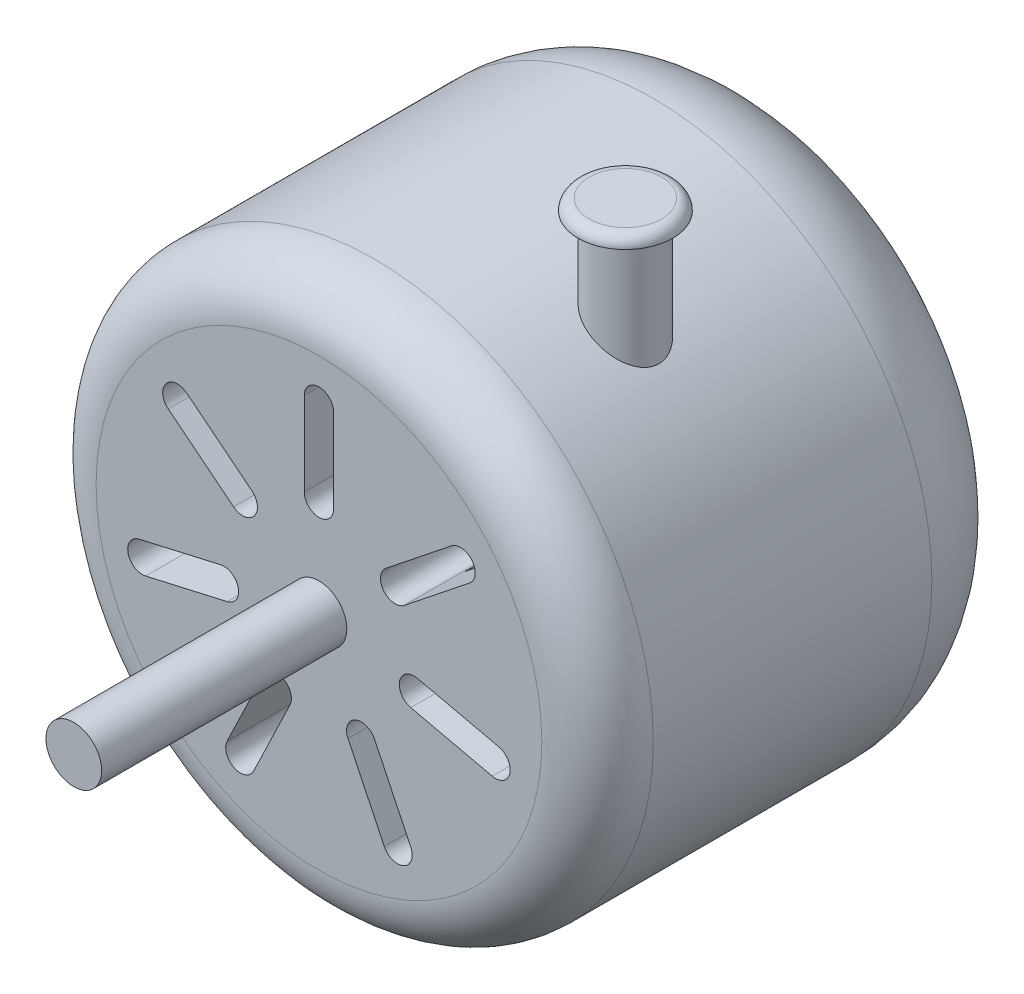
from build123d import *

# Parameters (mm, degrees)
SKETCH2_R           = 50
BOSS_EXTRUDE1_DEPTH = 80
FILLET1_R           = 10
FILLET2_R           = 20
CUT_EXTRUDE1_DEPTH  = 70
CIRPATTERN1_COUNT   = 7
CUT_EXTRUDE2_DEPTH  = 70
CIRPATTERN2_COUNT   = 6
SKETCH5_R           = 5
BOSS_EXTRUDE2_DEPTH = 44
SKETCH6_R           = 6
BOSS_EXTRUDE3_DEPTH = 60
SKETCH7_R           = 8.5
BOSS_EXTRUDE4_DEPTH = 2
FILLET3_R           = 2


with BuildPart() as part:
    # Sketch2 → Boss-Extrude1 (new body)
    with BuildSketch(Plane.XY):
        Circle(SKETCH2_R)
    extrude(amount=BOSS_EXTRUDE1_DEPTH)

    # Fillet1
    fillet1_edges = [part.edges().sort_by_distance(p)[0] for p in [
        (-50, 0, 80),
    ]]
    fillet(fillet1_edges, radius=FILLET1_R)

    # Fillet2
    fillet2_edges = [part.edges().sort_by_distance(p)[0] for p in [
        (-50, 0, 0),
    ]]
    fillet(fillet2_edges, radius=FILLET2_R)

    # Sketch3 → Cut-Extrude1 (cut)
    with BuildSketch(Plane.XY.offset(80)):
        with BuildLine():
            Line((2.637369311, 32.5), (2.637369311, 17.5))
            ThreePointArc((2.637369311, 17.5), (0, 14.862630689), (-2.637369311, 17.5))
            Line((-2.637369311, 17.5), (-2.637369311, 32.5))
            ThreePointArc((-2.637369311, 32.5), (0, 35.137369311), (2.637369311, 32.5))
        make_face()
    cut_extrude1 = extrude(amount=-CUT_EXTRUDE1_DEPTH, mode=Mode.SUBTRACT)

    # CirPattern1: Cut-Extrude1 ×7 about axis
    cirpattern1_axis = Axis((0, 0, 0), (0, 0, 1))
    for i in range(1, CIRPATTERN1_COUNT):
        add(cut_extrude1.rotate(cirpattern1_axis, i * 360 / CIRPATTERN1_COUNT), mode=Mode.SUBTRACT)

    # Sketch4 → Cut-Extrude2 (cut)
    with BuildSketch(Plane(origin=(0, 0, 0), x_dir=(-1, 0, 0), z_dir=(0, 0, -1))):
        with BuildLine():
            ThreePointArc((14.859250813, 18.841945384), (7.59472586, 23.542964366), (-0.866191396, 21.730291912))
            ThreePointArc((-0.866191396, 21.730291912), (-1.255977525, 19.608122991), (0.866191396, 19.218336862))
            ThreePointArc((0.866191396, 19.218336862), (7.043485031, 20.541764296), (12.347295763, 17.109562591))
            ThreePointArc((12.347295763, 17.109562591), (14.469464684, 16.719776462), (14.859250813, 18.841945384))
        make_face()
    cut_extrude2 = extrude(amount=-CUT_EXTRUDE2_DEPTH, mode=Mode.SUBTRACT)

    # CirPattern2: Cut-Extrude2 ×6 about axis
    cirpattern2_axis = Axis((0, 0, 0), (0, 0, 1))
    for i in range(1, CIRPATTERN2_COUNT):
        add(cut_extrude2.rotate(cirpattern2_axis, i * 360 / CIRPATTERN2_COUNT), mode=Mode.SUBTRACT)

    # Sketch5 → Boss-Extrude2 (add, symmetric)
    with BuildSketch(Plane.XY.offset(80)):
        Circle(SKETCH5_R)
    extrude(amount=BOSS_EXTRUDE2_DEPTH, both=True)

    # Sketch6 → Boss-Extrude3 (add)
    with BuildSketch(Plane(origin=(0, 0, 0), x_dir=(1, 0, 0), z_dir=(0, 1, 0))):
        with Locations(Location((25, -50, 0), (0, 0, 90))):
            Circle(SKETCH6_R)
    extrude(amount=BOSS_EXTRUDE3_DEPTH)


with BuildPart() as body_2:
    # Sketch7 → Boss-Extrude4 (new body)
    with BuildSketch(Plane(origin=(0, 60, 0), x_dir=(1, 0, 0), z_dir=(0, 1, 0))):
        with Locations(Location((25, -50, 0), (0, 0, 270))):
            Circle(SKETCH7_R)
    extrude(amount=BOSS_EXTRUDE4_DEPTH)

    # Fillet3
    fillet3_edges = [body_2.edges().sort_by_distance(p)[0] for p in [
        (25, 62, 41.5),
    ]]
    fillet(fillet3_edges, radius=FILLET3_R - 0.0001)  # a hair under: the kernel refuses the full size


solid = Compound([part.part, body_2.part])
